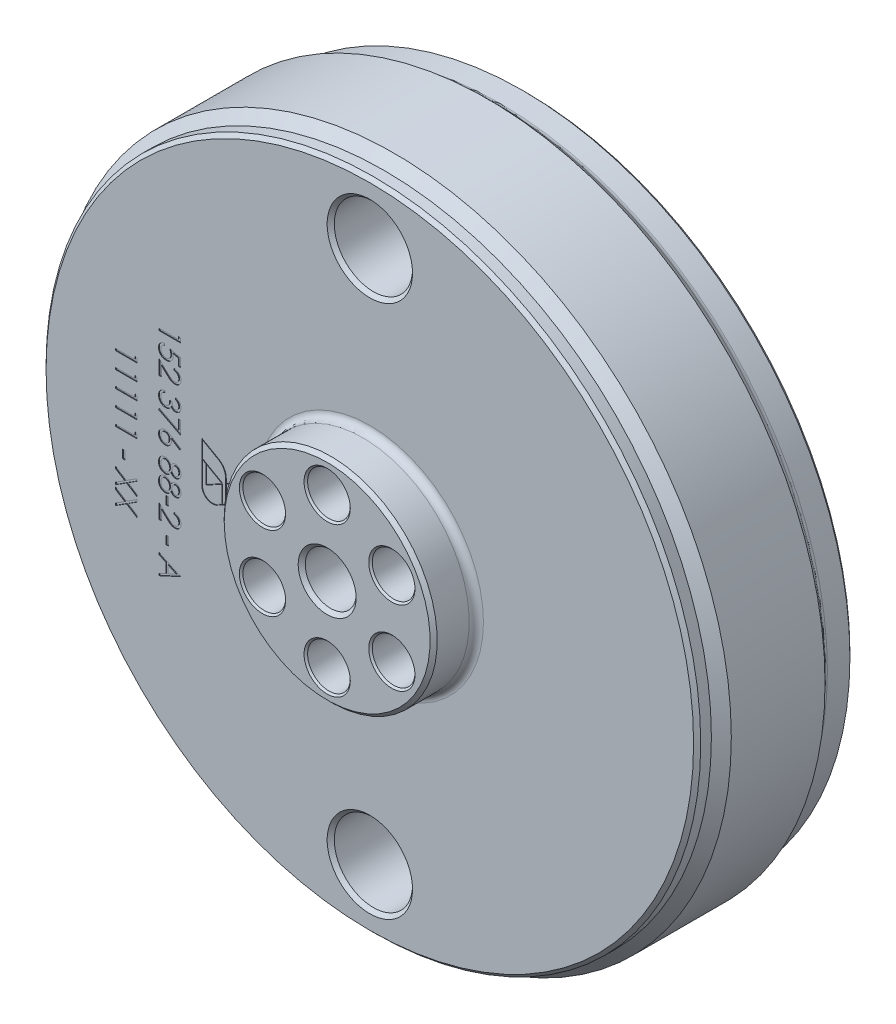
from build123d import *

# Parameters (mm, degrees)
F_11_0_11_DIAMETER_HOLE1_D           = 11
F_11_0_11_DIAMETER_HOLE1_DEPTH       = 10
F_11_0_11_DIAMETER_HOLE1_CSINK_D     = 12
F_11_0_11_DIAMETER_HOLE1_CSINK_ANGLE = 90
F_11_0_11_DIAMETER_HOLE1_TIP         = 3.304733405
CIRPATTERN1_COUNT                    = 6
SKETCH18_W                           = 0.307692308
SKETCH18_H                           = 1.153846154
SKETCH18_W_2                         = 0.307692307
CUT_EXTRUDE1_DEPTH                   = 0.1


with BuildPart() as part:
    # Sketch1 → Revolve1 (revolve)
    with BuildSketch(Plane(origin=(0, 0, 0), x_dir=(0, 0, -1), z_dir=(1, 0, 0))):
        with BuildLine():
            Line((0, 36.85), (0, 45.525))
            Line((0, 45.525), (-0.5, 46.025))
            Line((-0.5, 46.025), (-3.66862915, 46.025))
            ThreePointArc((-3.66862915, 46.025), (-3.974775896, 46.085896374), (-4.234314575, 46.259314575))
            Line((-4.234314575, 46.259314575), (-5.4, 47.425))
            Line((-5.4, 47.425), (-18.58, 47.425))
            Line((-18.58, 47.425), (-19.98, 46.025))
            Line((-19.98, 46.025), (-21.48, 46.025))
            Line((-21.48, 46.025), (-21.98, 45.525))
            Line((-21.98, 45.525), (-21.98, 15.975))
            ThreePointArc((-21.98, 15.975), (-22.272893219, 15.267893219), (-22.98, 14.975))
            Line((-22.98, 14.975), (-27.48, 14.975))
            Line((-27.48, 14.975), (-27.98, 14.475))
            Line((-27.98, 14.475), (-27.98, 4.075))
            Line((-27.98, 4.075), (-27.48, 3.575))
            Line((-27.48, 3.575), (-10.7, 3.575))
            Line((-10.7, 3.575), (-8.2, 6.075))
            Line((-8.2, 6.075), (-8.2, 24.107943651))
            ThreePointArc((-8.2, 24.107943651), (-6.29101439, 30.601896882), (-1.171428571, 35.029706236))
            ThreePointArc((-1.171428571, 35.029706236), (-0.318164268, 35.767674461), (0, 36.85))
        make_face()
    revolve(axis=Axis((0, 0, 0), (0, 0, 1)))

    # Ø11.0 (11) Diameter Hole1
    with Locations(Plane.XY.offset(21.98)):
        with Locations((0, -37.5), (0, 37.5)):
            CounterSinkHole(F_11_0_11_DIAMETER_HOLE1_D / 2, F_11_0_11_DIAMETER_HOLE1_CSINK_D / 2, depth=F_11_0_11_DIAMETER_HOLE1_DEPTH, counter_sink_angle=F_11_0_11_DIAMETER_HOLE1_CSINK_ANGLE)
            with Locations((0, 0, -(F_11_0_11_DIAMETER_HOLE1_DEPTH + F_11_0_11_DIAMETER_HOLE1_TIP / 2))):  # 118° drill point
                Cone(0, F_11_0_11_DIAMETER_HOLE1_D / 2, F_11_0_11_DIAMETER_HOLE1_TIP, mode=Mode.SUBTRACT)

    # Sketch22 → Ø6.0 (6) Diameter Hole1 (revolve, cut)
    with BuildSketch(Plane(origin=(0, 10.5, 27.98), x_dir=(0, -1, 0), z_dir=(1, 0, 0))):
        Polygon((0, 0), (0, 19.78), (3.25, 19.78), (3, 19.53), (3, 0.25), (3.25, 0), align=None)
    f_6_0_6_diameter_hole1 = revolve(axis=Axis((0, 10.5, 34.33), (0, 0, -1)), mode=Mode.SUBTRACT)

    # CirPattern1: Ø6.0 (6) Diameter Hole1 ×6 about axis
    cirpattern1_axis = Axis((0, 0, 0), (0, 0, -1))
    for i in range(1, CIRPATTERN1_COUNT):
        add(f_6_0_6_diameter_hole1.rotate(cirpattern1_axis, i * 360 / CIRPATTERN1_COUNT), mode=Mode.SUBTRACT)

    # Sketch18 → Cut-Extrude1 (cut)
    # profile 1 of 21: a face of its own
    with BuildSketch(Plane.XY.offset(21.98)):
        Polygon((-26.628822217, 13.250619533), (-26.628822217, 12.695932033), (-29.628822217, 12.695932033), (-29.628822217, 12.965162802), (-26.936514525, 12.965162802), (-26.936514525, 13.426701264), align=None)
    # profile 2 of 21: a face of its own
    with BuildSketch(Plane.XY.offset(21.98)):
        with BuildLine():
            Line((-26.628822217, 9.695932033), (-26.936514525, 9.695932033))
            Line((-26.936514525, 9.695932033), (-26.936514525, 10.715763764))
            Line((-26.936514525, 10.715763764), (-27.725577025, 10.878023379))
            add(Edge.make_bspline(
                [(-27.725577025, 10.878023379), (-27.71680822, 10.846261201), (-27.699820049, 10.784727004), (-27.68095796, 10.693904266), (-27.669587579, 10.607682378), (-27.668035027, 10.55173206), (-27.667283755, 10.524657994)],
                knots=[0, 0, 0, 0, 1.100273476, 2.13160584, 3.095893838, 4, 4, 4, 4], degree=3))
            add(Edge.make_bspline(
                [(-27.667283755, 10.524657994), (-27.668009033, 10.491157762), (-27.66943511, 10.425287934), (-27.68312257, 10.328910051), (-27.704680861, 10.236916394), (-27.73474862, 10.149464138), (-27.773445423, 10.066364921), (-27.821157772, 9.988082806), (-27.877555645, 9.91417414), (-27.942094898, 9.845615968), (-28.013212867, 9.783516462), (-28.089429113, 9.728701035), (-28.170812963, 9.68311229), (-28.257004543, 9.645605746), (-28.347859233, 9.615847925), (-28.444049538, 9.595987422), (-28.544721858, 9.582777507), (-28.613553999, 9.581300563), (-28.648653948, 9.580547417)],
                knots=[0, 0, 0, 0, 1.052772836, 2.070014431, 3.053871312, 4.019926262, 4.972333346, 5.930471369, 6.896690565, 7.89035727, 8.885779078, 9.861050232, 10.836829716, 11.812751485, 12.812646763, 13.836748493, 14.896881366, 16, 16, 16, 16], degree=3))
            add(Edge.make_bspline(
                [(-28.648653948, 9.580547417), (-28.673101597, 9.581117405), (-28.721666507, 9.582249678), (-28.793789638, 9.588009593), (-28.864388101, 9.599093162), (-28.933460839, 9.613995237), (-29.000915509, 9.633260375), (-29.066727573, 9.656835492), (-29.131099679, 9.684624743), (-29.194036042, 9.715999467), (-29.253596435, 9.752294207), (-29.310700262, 9.790526479), (-29.363245982, 9.832877314), (-29.413151864, 9.877296294), (-29.458458026, 9.925559551), (-29.501103313, 9.97616907), (-29.539235304, 10.030312532), (-29.574308126, 10.087020566), (-29.60571097, 10.146257413), (-29.63190655, 10.208623723), (-29.654867203, 10.272750392), (-29.673538927, 10.339208975), (-29.688025487, 10.40787072), (-29.697890637, 10.47897207), (-29.705068392, 10.552156252), (-29.705518121, 10.601763303), (-29.705745294, 10.626821456)],
                knots=[0, 0, 0, 0, 1.05623316, 2.098192244, 3.122504159, 4.140841222, 5.148757784, 6.150489607, 7.158294732, 8.176043417, 9.185147859, 10.169157858, 11.142149047, 12.097904048, 13.0527185, 13.998867679, 14.954465986, 15.910220987, 16.877849176, 17.847023716, 18.829548819, 19.818454515, 20.826519638, 21.858115382, 22.918063636, 24, 24, 24, 24], degree=3))
            add(Edge.make_bspline(
                [(-29.705745294, 10.626821456), (-29.705153095, 10.656713574), (-29.703988014, 10.715522786), (-29.691801481, 10.801683793), (-29.674343995, 10.884580122), (-29.648094174, 10.96355572), (-29.61515447, 11.039276907), (-29.573787959, 11.110735688), (-29.526255956, 11.179336619), (-29.470918445, 11.243215208), (-29.409866768, 11.302381948), (-29.344324097, 11.356159376), (-29.274029824, 11.403321858), (-29.19958239, 11.444061861), (-29.120853694, 11.478762301), (-29.037608154, 11.506035642), (-28.950264541, 11.528044742), (-28.890133064, 11.537356372), (-28.859591448, 11.542085879)],
                knots=[0, 0, 0, 0, 1.046825758, 2.059506013, 3.044032586, 4.011925612, 4.970610144, 5.93275819, 6.900651216, 7.891265644, 8.889116719, 9.876966323, 10.858259055, 11.851035124, 12.847502422, 13.86866322, 14.9174643, 16, 16, 16, 16], degree=3))
            Line((-28.859591448, 11.542085879), (-28.859591448, 11.27285511))
            add(Edge.make_bspline(
                [(-28.859591448, 11.27285511), (-28.888202565, 11.266234801), (-28.943194721, 11.2535102), (-29.020413833, 11.225506934), (-29.089485567, 11.191478853), (-29.150475131, 11.150095268), (-29.203938981, 11.101727901), (-29.251994253, 11.046931829), (-29.294773601, 10.98492641), (-29.330661809, 10.916051173), (-29.361224019, 10.843345127), (-29.381585545, 10.767261375), (-29.39589983, 10.689857015), (-29.39733287, 10.637504212), (-29.398052986, 10.611196456)],
                knots=[0, 0, 0, 0, 1.136389429, 2.184203582, 3.172920998, 4.111012962, 5.028380909, 5.957351669, 6.927793475, 7.937618031, 8.960409703, 9.974842029, 10.982339866, 12, 12, 12, 12], degree=3))
            add(Edge.make_bspline(
                [(-29.398052986, 10.611196456), (-29.397349462, 10.585517789), (-29.395964218, 10.534956284), (-29.385302208, 10.460546524), (-29.368881432, 10.388706918), (-29.344307271, 10.320146326), (-29.314440369, 10.253665007), (-29.276113161, 10.190944632), (-29.232004574, 10.130170737), (-29.18147032, 10.073232337), (-29.12578201, 10.021084238), (-29.066229959, 9.975007563), (-29.002701233, 9.936627351), (-28.936295673, 9.904283829), (-28.866285482, 9.879723859), (-28.79299876, 9.862203018), (-28.716254491, 9.851914682), (-28.663909369, 9.850499385), (-28.637235679, 9.849778187)],
                knots=[0, 0, 0, 0, 1.027316725, 2.022795036, 3.002884548, 3.971462791, 4.93288096, 5.914575861, 6.907176829, 7.935150275, 8.956128384, 9.956726525, 10.942570165, 11.921478529, 12.907843606, 13.90538589, 14.932640048, 16, 16, 16, 16], degree=3))
            add(Edge.make_bspline(
                [(-28.637235679, 9.849778187), (-28.613156248, 9.850251689), (-28.565997179, 9.851179035), (-28.497306463, 9.861484119), (-28.431840212, 9.875919942), (-28.370183867, 9.898084308), (-28.311434561, 9.925470263), (-28.256849744, 9.960214621), (-28.205027037, 9.999931002), (-28.158071716, 10.046449868), (-28.114441636, 10.097176716), (-28.07730271, 10.153289084), (-28.046044376, 10.213507095), (-28.019072786, 10.277133787), (-27.999700445, 10.34567476), (-27.98515662, 10.417774835), (-27.976743431, 10.494211984), (-27.975576101, 10.546472578), (-27.974976063, 10.573335879)],
                knots=[0, 0, 0, 0, 1.045726679, 2.048034203, 3.01323695, 3.95502507, 4.889743367, 5.8246644, 6.761650845, 7.722168973, 8.692072792, 9.66525385, 10.638902184, 11.638179751, 12.663148338, 13.728659964, 14.832472288, 16, 16, 16, 16], degree=3))
            add(Edge.make_bspline(
                [(-27.974976063, 10.573335879), (-27.975456814, 10.596791184), (-27.976440985, 10.644807836), (-27.984186208, 10.718633355), (-27.996101488, 10.795875298), (-28.013275209, 10.876833542), (-28.03477789, 10.961285912), (-28.061632043, 11.049372853), (-28.092564641, 11.141096492), (-28.116557018, 11.20283307), (-28.128822217, 11.234393571)],
                knots=[0, 0, 0, 0, 0.824638674, 1.688163388, 2.607705698, 3.571998603, 4.597075385, 5.671199175, 6.809488238, 8, 8, 8, 8], degree=3))
            Line((-28.128822217, 11.234393571), (-26.628822217, 10.926701264))
            Line((-26.628822217, 10.926701264), (-26.628822217, 9.695932033))
        make_face()
    # profile 3 of 21: a face of its own
    with BuildSketch(Plane.XY.offset(21.98)):
        with BuildLine():
            Line((-27.55189914, 8.888239725), (-27.55189914, 9.157470494))
            add(Edge.make_bspline(
                [(-27.55189914, 9.157470494), (-27.51618106, 9.15571609), (-27.446031702, 9.152270488), (-27.343756559, 9.136127728), (-27.245986286, 9.113050843), (-27.153559084, 9.080345514), (-27.065370832, 9.03995729), (-26.982592567, 8.990510416), (-26.904402726, 8.933059019), (-26.832281702, 8.867708496), (-26.766354068, 8.796797156), (-26.708819713, 8.720749867), (-26.660764983, 8.640348253), (-26.620373874, 8.556289682), (-26.590092255, 8.467601993), (-26.567613922, 8.375132939), (-26.554092061, 8.278464571), (-26.552638431, 8.212601769), (-26.55189914, 8.17910511)],
                knots=[0, 0, 0, 0, 1.100776268, 2.161895295, 3.184016182, 4.190939212, 5.176500551, 6.166955529, 7.155448256, 8.160289653, 9.16017456, 10.133824356, 11.091467644, 12.04088621, 13.000931625, 13.972173743, 14.968683325, 16, 16, 16, 16], degree=3))
            add(Edge.make_bspline(
                [(-26.55189914, 8.17910511), (-26.552669246, 8.146209618), (-26.554182475, 8.081571151), (-26.567177643, 7.987232281), (-26.587531008, 7.897423172), (-26.616087079, 7.812319372), (-26.654473731, 7.732599888), (-26.700585907, 7.65766585), (-26.753917191, 7.586625155), (-26.816706174, 7.522676483), (-26.883736789, 7.463955272), (-26.955297849, 7.413296196), (-27.029208666, 7.369913485), (-27.106032838, 7.333752616), (-27.18649372, 7.307133069), (-27.269419894, 7.286923176), (-27.355669732, 7.275499679), (-27.414046779, 7.273746459), (-27.443726063, 7.27285511)],
                knots=[0, 0, 0, 0, 1.111607364, 2.184268762, 3.212621178, 4.221274766, 5.211760367, 6.196651075, 7.1921475, 8.207485113, 9.220403448, 10.201281604, 11.166441695, 12.114753415, 13.065576456, 14.026450734, 14.996634279, 16, 16, 16, 16], degree=3))
            add(Edge.make_bspline(
                [(-27.443726063, 7.27285511), (-27.485509907, 7.274304523), (-27.568344347, 7.277177916), (-27.690258855, 7.301856794), (-27.808284761, 7.34025143), (-27.903643566, 7.385879093), (-27.980003694, 7.432628056), (-28.042989268, 7.474678147), (-28.110790087, 7.523941471), (-28.183200423, 7.58109208), (-28.260780833, 7.644960991), (-28.343486482, 7.716122624), (-28.430462252, 7.795085674), (-28.489867058, 7.850507237), (-28.52064914, 7.879225302)],
                knots=[0, 0, 0, 0, 1.184136889, 2.347493852, 3.513608722, 4.697895552, 5.335178528, 6.052199267, 6.845488095, 7.711597353, 8.668264519, 9.695616787, 10.805926351, 12, 12, 12, 12], degree=3))
            Line((-28.52064914, 7.879225302), (-29.321129909, 8.629826264))
            Line((-29.321129909, 8.629826264), (-29.321129909, 7.234393571))
            Line((-29.321129909, 7.234393571), (-29.628822217, 7.234393571))
            Line((-29.628822217, 7.234393571), (-29.628822217, 9.27285511))
            Line((-29.628822217, 9.27285511), (-28.387235679, 8.109393571))
            add(Edge.make_bspline(
                [(-28.387235679, 8.109393571), (-28.357667314, 8.081064806), (-28.300872538, 8.026651044), (-28.217928782, 7.949720935), (-28.141071065, 7.880514184), (-28.069958814, 7.818984883), (-28.004995167, 7.765082406), (-27.94567102, 7.718979216), (-27.892495475, 7.680471545), (-27.830027069, 7.639661439), (-27.753666329, 7.600746295), (-27.660818905, 7.566543865), (-27.565028397, 7.545838179), (-27.500315611, 7.543341653), (-27.467764525, 7.542085879)],
                knots=[0, 0, 0, 0, 1.329530082, 2.553755191, 3.672934919, 4.687409497, 5.60679272, 6.413407421, 7.126401618, 7.737995624, 8.834647426, 9.90044882, 10.943907757, 12, 12, 12, 12], degree=3))
            add(Edge.make_bspline(
                [(-27.467764525, 7.542085879), (-27.447292493, 7.542625203), (-27.406946049, 7.543688109), (-27.347830711, 7.553246448), (-27.29058597, 7.567289546), (-27.235919617, 7.588934297), (-27.18275647, 7.614939669), (-27.132712854, 7.64816345), (-27.084082903, 7.686129507), (-27.038534097, 7.73016827), (-26.996804317, 7.77851465), (-26.959841607, 7.829597094), (-26.928950734, 7.883639607), (-26.903627792, 7.940416971), (-26.883763165, 7.999770199), (-26.869998672, 8.061814275), (-26.861356542, 8.126377715), (-26.860187252, 8.170463569), (-26.859591448, 8.192927225)],
                knots=[0, 0, 0, 0, 0.991504627, 1.954065223, 2.895985987, 3.842598665, 4.797835564, 5.759220273, 6.74786863, 7.784730864, 8.824135544, 9.839918996, 10.835834653, 11.835434876, 12.84861661, 13.863796685, 14.911511676, 16, 16, 16, 16], degree=3))
            add(Edge.make_bspline(
                [(-26.859591448, 8.192927225), (-26.860204147, 8.216388043), (-26.861407388, 8.262461216), (-26.869829444, 8.330104624), (-26.884344878, 8.394640667), (-26.90424523, 8.456199986), (-26.929299932, 8.514841892), (-26.961108762, 8.570036145), (-26.998429786, 8.62228665), (-27.040973717, 8.671497442), (-27.088564146, 8.716714439), (-27.140961946, 8.757277759), (-27.198507959, 8.791873983), (-27.259902395, 8.822541979), (-27.326777654, 8.846007534), (-27.397513196, 8.866065665), (-27.473114003, 8.880636414), (-27.525201247, 8.885663194), (-27.55189914, 8.888239725)],
                knots=[0, 0, 0, 0, 1.031212865, 2.025131798, 2.990757446, 3.934781266, 4.865570067, 5.788494791, 6.729227313, 7.684356718, 8.643577152, 9.610526866, 10.590658432, 11.59095419, 12.621640561, 13.700587263, 14.82141059, 16, 16, 16, 16], degree=3))
        make_face()
    # profile 4 of 21: a face of its own
    with BuildSketch(Plane.XY.offset(21.98)):
        with BuildLine():
            Line((-27.321129909, 5.426701264), (-27.321129909, 5.695932033))
            add(Edge.make_bspline(
                [(-27.321129909, 5.695932033), (-27.290930637, 5.688638132), (-27.231893531, 5.674379153), (-27.14754445, 5.644638376), (-27.067724289, 5.612239014), (-26.993927654, 5.573334067), (-26.924671452, 5.530897992), (-26.861526488, 5.482278517), (-26.802886803, 5.429718755), (-26.750846885, 5.371583084), (-26.703723118, 5.31061566), (-26.663544497, 5.245957414), (-26.628980937, 5.178909219), (-26.600506453, 5.109006534), (-26.579056004, 5.036041244), (-26.563493028, 4.960672996), (-26.553386358, 4.882704281), (-26.55239999, 4.829777775), (-26.55189914, 4.802903187)],
                knots=[0, 0, 0, 0, 1.162005537, 2.271625781, 3.343758855, 4.383309926, 5.390229558, 6.379919256, 7.361854164, 8.333198761, 9.295911338, 10.242430842, 11.177959212, 12.116337295, 13.062827104, 14.020064771, 14.994644689, 16, 16, 16, 16], degree=3))
            add(Edge.make_bspline(
                [(-26.55189914, 4.802903187), (-26.553081337, 4.763746551), (-26.555419945, 4.686287398), (-26.576775176, 4.572490501), (-26.610568147, 4.462753227), (-26.657259913, 4.358276729), (-26.714849039, 4.261232358), (-26.783390242, 4.174887056), (-26.861561071, 4.100411189), (-26.947903269, 4.037930294), (-27.04017942, 3.989008866), (-27.135150984, 3.952934832), (-27.232592673, 3.930973391), (-27.298384627, 3.928127199), (-27.331346255, 3.926701264)],
                knots=[0, 0, 0, 0, 1.083050992, 2.142477498, 3.193116406, 4.255571735, 5.30263384, 6.308962982, 7.297363603, 8.282367274, 9.249857812, 10.179914175, 11.08814088, 12, 12, 12, 12], degree=3))
            add(Edge.make_bspline(
                [(-27.331346255, 3.926701264), (-27.363066365, 3.927698627), (-27.425137698, 3.929650313), (-27.515756124, 3.946222061), (-27.60116321, 3.974110286), (-27.681718492, 4.012741511), (-27.756911211, 4.062748554), (-27.826910546, 4.123325152), (-27.892026968, 4.194898862), (-27.929329373, 4.249137952), (-27.948533755, 4.27706184)],
                knots=[0, 0, 0, 0, 1.024540389, 2.004866551, 2.965041327, 3.920577974, 4.882998113, 5.874504559, 6.905732034, 8, 8, 8, 8], degree=3))
            add(Edge.make_bspline(
                [(-27.948533755, 4.27706184), (-27.963943617, 4.245148908), (-27.994475009, 4.181920159), (-28.054351373, 4.09573399), (-28.123485385, 4.017495812), (-28.17743623, 3.973864052), (-28.204543371, 3.951941648)],
                knots=[0, 0, 0, 0, 1.015518401, 2.012035669, 3.001164323, 4, 4, 4, 4], degree=3))
            add(Edge.make_bspline(
                [(-28.204543371, 3.951941648), (-28.224305052, 3.937500336), (-28.263504802, 3.908854198), (-28.326566795, 3.8735953), (-28.390118994, 3.841242885), (-28.456660188, 3.817432445), (-28.524052957, 3.796884978), (-28.59374045, 3.783365429), (-28.665060576, 3.774686419), (-28.713332038, 3.773467709), (-28.737596255, 3.77285511)],
                knots=[0, 0, 0, 0, 1.02516404, 2.033540309, 3.025129118, 4.011046665, 4.991655828, 5.976607087, 6.982917762, 8, 8, 8, 8], degree=3))
            add(Edge.make_bspline(
                [(-28.737596255, 3.77285511), (-28.779602917, 3.774396651), (-28.863418557, 3.777472479), (-28.98727909, 3.804853739), (-29.108145438, 3.847546947), (-29.224226756, 3.907114835), (-29.332609536, 3.98081596), (-29.429142704, 4.068984251), (-29.512678917, 4.169476351), (-29.582250329, 4.28163456), (-29.637904457, 4.403095718), (-29.676522349, 4.533020556), (-29.701676818, 4.669519812), (-29.70437403, 4.763126176), (-29.705745294, 4.810715687)],
                knots=[0, 0, 0, 0, 0.95570045, 1.906903359, 2.87519758, 3.868912786, 4.869932978, 5.851730567, 6.836639976, 7.83677598, 8.849487602, 9.869908895, 10.917060885, 12, 12, 12, 12], degree=3))
            add(Edge.make_bspline(
                [(-29.705745294, 4.810715687), (-29.705001111, 4.842789373), (-29.703536808, 4.905899691), (-29.693526578, 4.998679833), (-29.675243716, 5.087241289), (-29.650640883, 5.171703802), (-29.619447961, 5.252142404), (-29.580603363, 5.328311637), (-29.53490779, 5.400680118), (-29.481821857, 5.468564933), (-29.422437852, 5.531957991), (-29.355701558, 5.589174612), (-29.28284664, 5.64116872), (-29.203026878, 5.686548124), (-29.1172738, 5.727379798), (-29.024489373, 5.760963475), (-28.925503068, 5.790522534), (-28.856522148, 5.804265503), (-28.821129909, 5.811316648)],
                knots=[0, 0, 0, 0, 1.048658725, 2.063410685, 3.046034179, 4.001477787, 4.936774919, 5.862367409, 6.792675028, 7.730719943, 8.675894397, 9.627829632, 10.600096036, 11.597688215, 12.626045268, 13.701542398, 14.82072376, 16, 16, 16, 16], degree=3))
            Line((-28.821129909, 5.811316648), (-28.821129909, 5.542085879))
            add(Edge.make_bspline(
                [(-28.821129909, 5.542085879), (-28.844229064, 5.535071629), (-28.889158925, 5.521428304), (-28.953822044, 5.49820462), (-29.013100375, 5.471746101), (-29.067428766, 5.443362194), (-29.117342254, 5.413552097), (-29.161520998, 5.380196447), (-29.201905457, 5.345765751), (-29.224657982, 5.31981202), (-29.235793371, 5.307109917)],
                knots=[0, 0, 0, 0, 1.198163088, 2.33053128, 3.407730985, 4.417276592, 5.372219308, 6.28897303, 7.162600585, 8, 8, 8, 8], degree=3))
            add(Edge.make_bspline(
                [(-29.235793371, 5.307109917), (-29.248743371, 5.290312852), (-29.274603399, 5.256770569), (-29.307604794, 5.202112086), (-29.336199959, 5.144627897), (-29.358043127, 5.083072462), (-29.376538265, 5.018774088), (-29.388641567, 4.950693489), (-29.396945714, 4.879431303), (-29.397678512, 4.83077322), (-29.398052986, 4.805907994)],
                knots=[0, 0, 0, 0, 0.946170439, 1.889420265, 2.845303464, 3.807233317, 4.801018734, 5.828864929, 6.890507805, 8, 8, 8, 8], degree=3))
            add(Edge.make_bspline(
                [(-29.398052986, 4.805907994), (-29.397525926, 4.777833183), (-29.396495305, 4.722935314), (-29.386989847, 4.642836459), (-29.373206637, 4.566611104), (-29.351647016, 4.495037131), (-29.32578269, 4.427140593), (-29.291921539, 4.364437136), (-29.253680844, 4.305083357), (-29.20919956, 4.250818047), (-29.161120108, 4.201895217), (-29.110112093, 4.159620486), (-29.057757097, 4.123005735), (-29.002833783, 4.093573585), (-28.945880906, 4.070291373), (-28.886685288, 4.054451382), (-28.825745396, 4.043435065), (-28.784320481, 4.042538068), (-28.763437602, 4.042085879)],
                knots=[0, 0, 0, 0, 1.216990249, 2.379719373, 3.493992396, 4.571561497, 5.616923107, 6.638958652, 7.655775068, 8.674704564, 9.676001865, 10.625896028, 11.54399481, 12.441854662, 13.322657739, 14.20572845, 15.095482574, 16, 16, 16, 16], degree=3))
            add(Edge.make_bspline(
                [(-28.763437602, 4.042085879), (-28.735484994, 4.043397543), (-28.679718867, 4.046014343), (-28.597675705, 4.065993475), (-28.51862522, 4.098853998), (-28.443927488, 4.144864338), (-28.374663352, 4.200846006), (-28.313104514, 4.2662571), (-28.261798772, 4.341258075), (-28.226481824, 4.410731798), (-28.202944563, 4.472417801), (-28.186440676, 4.525102549), (-28.173247761, 4.584136906), (-28.16048624, 4.648812176), (-28.14978779, 4.719401129), (-28.140827419, 4.795967359), (-28.133668977, 4.87854167), (-28.130470463, 4.935705412), (-28.128822217, 4.965162802)],
                knots=[0, 0, 0, 0, 1.070481957, 2.135637345, 3.216366529, 4.339485895, 5.485746587, 6.620975969, 7.768829582, 8.956804399, 9.598399438, 10.297751078, 11.070570279, 11.915248466, 12.824061284, 13.805856426, 14.869322739, 16, 16, 16, 16], degree=3))
            Line((-28.128822217, 4.965162802), (-27.821129909, 4.965162802))
            add(Edge.make_bspline(
                [(-27.821129909, 4.965162802), (-27.820497331, 4.928048543), (-27.819258267, 4.855350827), (-27.804375772, 4.749141268), (-27.783557121, 4.647458168), (-27.752404777, 4.55262256), (-27.715013074, 4.466465124), (-27.672851198, 4.391306253), (-27.625083684, 4.328927184), (-27.572337435, 4.279172067), (-27.515105856, 4.242653579), (-27.456080001, 4.215242836), (-27.393886535, 4.199173547), (-27.351466548, 4.197016342), (-27.330144332, 4.195932033)],
                knots=[0, 0, 0, 0, 1.321708579, 2.588902423, 3.815526512, 5.016621128, 6.138757764, 7.158873101, 8.079948563, 8.928590313, 9.728601868, 10.489025425, 11.240515403, 12, 12, 12, 12], degree=3))
            add(Edge.make_bspline(
                [(-27.330144332, 4.195932033), (-27.314477656, 4.196287201), (-27.283309546, 4.196993791), (-27.237774326, 4.20590635), (-27.193628595, 4.21929612), (-27.151072661, 4.237715994), (-27.110353538, 4.262325734), (-27.071421271, 4.291865621), (-27.033623397, 4.326349912), (-26.998768211, 4.366679853), (-26.965890846, 4.410341315), (-26.937469587, 4.457745125), (-26.913379746, 4.507845735), (-26.893476403, 4.560689215), (-26.87851391, 4.616487255), (-26.867768172, 4.674966637), (-26.861050385, 4.736241941), (-26.860083144, 4.778046262), (-26.859591448, 4.799297417)],
                knots=[0, 0, 0, 0, 0.884317272, 1.759307272, 2.611736065, 3.488921043, 4.37244062, 5.294096728, 6.247679003, 7.258495569, 8.302441962, 9.333537773, 10.376747089, 11.440883505, 12.520330301, 13.637364711, 14.798958396, 16, 16, 16, 16], degree=3))
            add(Edge.make_bspline(
                [(-26.859591448, 4.799297417), (-26.86078173, 4.833457119), (-26.863106629, 4.90017896), (-26.883541443, 4.996347448), (-26.915918299, 5.085656786), (-26.955013256, 5.153692486), (-26.993472221, 5.204017695), (-27.026558468, 5.240669099), (-27.064071496, 5.276004807), (-27.107040245, 5.308638214), (-27.153987192, 5.340524782), (-27.205170905, 5.371360042), (-27.261321111, 5.400153566), (-27.300807553, 5.417680655), (-27.321129909, 5.426701264)],
                knots=[0, 0, 0, 0, 1.4727372, 2.876598283, 4.222346151, 5.558423782, 6.24313385, 6.953189256, 7.68715613, 8.463578749, 9.278833271, 10.135787152, 11.040551781, 12, 12, 12, 12], degree=3))
        make_face()
    # profile 5 of 21: a face of its own
    with BuildSketch(Plane.XY.offset(21.98)):
        Polygon((-26.628822217, 3.311316648), (-26.628822217, 1.465162802), (-29.705745294, 3.042085879), (-29.577740486, 3.274657994), (-26.936514525, 1.92129261), (-26.936514525, 3.311316648), align=None)
    # profile 6 of 21: a face of its own
    with BuildSketch(Plane.XY.offset(21.98)):
        with BuildLine():
            Line((-26.55189914, -0.188683352), (-26.714759717, -0.396616044))
            Line((-26.714759717, -0.396616044), (-27.92689914, 0.396052225))
            add(Edge.make_bspline(
                [(-27.92689914, 0.396052225), (-27.91848726, 0.343277702), (-27.902078935, 0.240335028), (-27.899372125, 0.136135686), (-27.898052986, 0.08535511)],
                knots=[0, 0, 0, 0, 1.025318673, 2, 2, 2, 2], degree=3))
            add(Edge.make_bspline(
                [(-27.898052986, 0.08535511), (-27.898860641, 0.054862864), (-27.900445227, -0.004961687), (-27.912967724, -0.092865487), (-27.932458922, -0.177351824), (-27.960985473, -0.25823222), (-27.997414072, -0.335609324), (-28.041076501, -0.409925592), (-28.094224079, -0.479784478), (-28.153594082, -0.546085483), (-28.219351486, -0.606280139), (-28.289124064, -0.659573901), (-28.362839104, -0.704339722), (-28.440459275, -0.740660227), (-28.521864926, -0.768864408), (-28.606951903, -0.789425247), (-28.695778878, -0.801579184), (-28.756188743, -0.803229604), (-28.786875102, -0.804067967)],
                knots=[0, 0, 0, 0, 1.044136307, 2.048553127, 3.035567123, 4.010001674, 4.980053131, 5.96154148, 6.956538004, 7.981742224, 9.006487041, 10.005615874, 10.984750588, 11.954802044, 12.935714515, 13.930994945, 14.949008866, 16, 16, 16, 16], degree=3))
            add(Edge.make_bspline(
                [(-28.786875102, -0.804067967), (-28.828832748, -0.802502371), (-28.911346786, -0.799423465), (-29.032030284, -0.777010338), (-29.146080075, -0.738330287), (-29.253944354, -0.686581018), (-29.352484805, -0.61944041), (-29.441538949, -0.539875098), (-29.519162718, -0.447132968), (-29.585752916, -0.343410173), (-29.638658744, -0.231149898), (-29.677773103, -0.113441327), (-29.701144926, 0.00870943), (-29.704204784, 0.091666601), (-29.705745294, 0.133432033)],
                knots=[0, 0, 0, 0, 1.031881447, 2.029301251, 3.006342947, 3.987068354, 4.962916383, 5.929513747, 6.915671209, 7.928552063, 8.953527267, 9.960179832, 10.973036711, 12, 12, 12, 12], degree=3))
            add(Edge.make_bspline(
                [(-29.705745294, 0.133432033), (-29.704435407, 0.173800641), (-29.701840749, 0.253763786), (-29.67872704, 0.371391782), (-29.641263992, 0.484417656), (-29.589651064, 0.592046932), (-29.524461157, 0.69175635), (-29.44596975, 0.780933216), (-29.355911594, 0.859267267), (-29.254010422, 0.924114002), (-29.14521614, 0.976964267), (-29.030740922, 1.014240323), (-28.912888629, 1.038346845), (-28.832665191, 1.04083396), (-28.792283755, 1.042085879)],
                knots=[0, 0, 0, 0, 1.011913813, 2.004424092, 2.994488568, 3.992479987, 4.990471406, 5.973328987, 6.963763268, 7.974390938, 8.994854117, 9.989689954, 10.988086187, 12, 12, 12, 12], degree=3))
            add(Edge.make_bspline(
                [(-28.792283755, 1.042085879), (-28.761399648, 1.040998638), (-28.698368261, 1.038779686), (-28.602629313, 1.02553724), (-28.505051687, 1.001248976), (-28.422332556, 0.974963766), (-28.353826128, 0.948880904), (-28.299728412, 0.924696273), (-28.242599486, 0.897654909), (-28.183520287, 0.865958665), (-28.120802794, 0.832358088), (-28.056769627, 0.793108801), (-27.989082096, 0.752151568), (-27.94401679, 0.722147342), (-27.920889525, 0.70674934)],
                knots=[0, 0, 0, 0, 1.17367173, 2.395347028, 3.66355231, 4.98980831, 5.690886799, 6.447442954, 7.240630024, 8.091733897, 8.994365608, 9.943299771, 10.944512865, 12, 12, 12, 12], degree=3))
            Line((-27.920889525, 0.70674934), (-26.55189914, -0.188683352))
        make_face()
        with BuildLine():
            add(Edge.make_bspline(
                [(-28.205745294, 0.141845494), (-28.206421024, 0.164698129), (-28.207746801, 0.209534809), (-28.215234769, 0.275233742), (-28.229422502, 0.337245535), (-28.24777439, 0.396278898), (-28.27276277, 0.451716982), (-28.30275233, 0.504197966), (-28.338421284, 0.553179575), (-28.379311107, 0.597882168), (-28.423695616, 0.638779694), (-28.47087143, 0.674782998), (-28.520647346, 0.705133962), (-28.572595096, 0.729931898), (-28.626986151, 0.749197801), (-28.683520384, 0.763145088), (-28.7425904, 0.770904618), (-28.782646747, 0.772195788), (-28.803101063, 0.77285511)],
                knots=[0, 0, 0, 0, 1.129054775, 2.21519617, 3.259426851, 4.267013074, 5.263608451, 6.256463875, 7.247987236, 8.249677815, 9.244060445, 10.225610515, 11.175892485, 12.118571871, 13.063688666, 14.021206195, 14.989551517, 16, 16, 16, 16], degree=3))
            add(Edge.make_bspline(
                [(-28.803101063, 0.77285511), (-28.823371703, 0.772316845), (-28.86311941, 0.771261388), (-28.92170686, 0.761721998), (-28.978035481, 0.747046454), (-29.03214647, 0.725565348), (-29.083744662, 0.698621759), (-29.133196572, 0.665464702), (-29.180536334, 0.626655605), (-29.224570207, 0.581540801), (-29.264959146, 0.532888859), (-29.300921532, 0.481436207), (-29.331120321, 0.427346446), (-29.354994843, 0.370310933), (-29.374548646, 0.311128212), (-29.388318344, 0.249346796), (-29.396100918, 0.184912401), (-29.397393756, 0.141265097), (-29.398052986, 0.119008956)],
                knots=[0, 0, 0, 0, 0.989642335, 1.94054129, 2.892446913, 3.828371744, 4.778262963, 5.730973156, 6.732161388, 7.763274768, 8.805796303, 9.818398792, 10.825975928, 11.825728216, 12.834635236, 13.867465554, 14.912602056, 16, 16, 16, 16], degree=3))
            add(Edge.make_bspline(
                [(-29.398052986, 0.119008956), (-29.397393808, 0.096752778), (-29.396101071, 0.053105402), (-29.388317763, -0.011328474), (-29.374550781, -0.073111806), (-29.354987106, -0.132287564), (-29.331149022, -0.189348782), (-29.300732302, -0.243485891), (-29.265177799, -0.295429779), (-29.224500693, -0.344049804), (-29.180785146, -0.389353176), (-29.132767943, -0.427253278), (-29.084137698, -0.461457841), (-29.031940854, -0.487366603), (-28.978068055, -0.509086942), (-28.921698134, -0.523688441), (-28.863121694, -0.533247573), (-28.823372474, -0.534300317), (-28.803101063, -0.534837198)],
                knots=[0, 0, 0, 0, 1.087205562, 2.132157158, 3.164804748, 4.173533273, 5.173108684, 6.180507559, 7.20098426, 8.243321352, 9.274252308, 10.269075238, 11.227079059, 12.172305571, 13.108064818, 14.05980203, 15.010532752, 16, 16, 16, 16], degree=3))
            add(Edge.make_bspline(
                [(-28.803101063, -0.534837198), (-28.782617642, -0.534371016), (-28.742415349, -0.533456052), (-28.683574121, -0.522906902), (-28.626524504, -0.508658519), (-28.572551631, -0.485631826), (-28.520162935, -0.458205156), (-28.470855725, -0.423265379), (-28.423233118, -0.38320607), (-28.37904829, -0.336813503), (-28.338633252, -0.286342544), (-28.302960203, -0.232670356), (-28.272852868, -0.176521108), (-28.247732503, -0.11794904), (-28.229604565, -0.056283738), (-28.215329597, 0.007479395), (-28.207759228, 0.073956741), (-28.206423228, 0.118992669), (-28.205745294, 0.141845494)],
                knots=[0, 0, 0, 0, 0.978850575, 1.921165339, 2.853482305, 3.786193361, 4.721019802, 5.678231452, 6.671107257, 7.694736563, 8.738100728, 9.761595396, 10.773671158, 11.783065439, 12.804898115, 13.84455739, 14.906252091, 16, 16, 16, 16], degree=3))
        make_face(mode=Mode.SUBTRACT)
    # profile 7 of 21: a face of its own
    with BuildSketch(Plane.XY.offset(21.98)):
        with BuildLine():
            add(Edge.make_bspline(
                [(-27.957548179, -3.724140083), (-27.970367794, -3.74848838), (-27.995448533, -3.796124233), (-28.035702991, -3.864282104), (-28.077754049, -3.927033916), (-28.12028169, -3.985273966), (-28.164966904, -4.037814353), (-28.211299639, -4.085002739), (-28.258038789, -4.128319544), (-28.307013179, -4.165487447), (-28.357212701, -4.198262696), (-28.409068868, -4.2265496), (-28.462418118, -4.250738217), (-28.51785598, -4.269905801), (-28.574564618, -4.285696085), (-28.633277216, -4.296560842), (-28.69360664, -4.302403927), (-28.734379471, -4.303508622), (-28.75502414, -4.304067967)],
                knots=[0, 0, 0, 0, 1.264385854, 2.473688339, 3.635349404, 4.734491366, 5.785876313, 6.801388178, 7.772322209, 8.711311751, 9.622826105, 10.524996139, 11.423212571, 12.31118177, 13.217849097, 14.126010572, 15.051135535, 16, 16, 16, 16], degree=3))
            add(Edge.make_bspline(
                [(-28.75502414, -4.304067967), (-28.783909894, -4.303412631), (-28.84108564, -4.302115476), (-28.925439186, -4.290629976), (-29.00755858, -4.273867129), (-29.08664991, -4.247763752), (-29.163704286, -4.216584894), (-29.23731283, -4.176475117), (-29.309533821, -4.13146321), (-29.353945937, -4.095235598), (-29.376418371, -4.076904506)],
                knots=[0, 0, 0, 0, 1.02534174, 2.029536028, 3.018826961, 3.997522084, 4.983122576, 5.966563916, 6.971085759, 8, 8, 8, 8], degree=3))
            add(Edge.make_bspline(
                [(-29.376418371, -4.076904506), (-29.402641606, -4.053044671), (-29.454764028, -4.005619843), (-29.522436151, -3.924377334), (-29.57930706, -3.835215719), (-29.625654398, -3.738480005), (-29.661727992, -3.634428775), (-29.68765015, -3.5230842), (-29.702497946, -3.404229212), (-29.704644223, -3.322538808), (-29.705745294, -3.280630467)],
                knots=[0, 0, 0, 0, 0.954267603, 1.896743057, 2.838368354, 3.796610408, 4.779680527, 5.799409237, 6.871065594, 8, 8, 8, 8], degree=3))
            add(Edge.make_bspline(
                [(-29.705745294, -3.280630467), (-29.704754805, -3.240334205), (-29.702827413, -3.161921772), (-29.689840111, -3.047773673), (-29.666847624, -2.941240529), (-29.636028437, -2.841817271), (-29.594930351, -2.750465198), (-29.544555976, -2.667018544), (-29.486043131, -2.59025304), (-29.417981644, -2.52258136), (-29.345072863, -2.462506413), (-29.269857716, -2.409733577), (-29.192326134, -2.365870137), (-29.113634997, -2.328732612), (-29.032681142, -2.300302882), (-28.949881133, -2.280612415), (-28.865379581, -2.268107289), (-28.80835245, -2.266443459), (-28.779663563, -2.265606429)],
                knots=[0, 0, 0, 0, 1.256882982, 2.445766618, 3.576898315, 4.651879663, 5.686612882, 6.692806257, 7.686348993, 8.689277895, 9.678883454, 10.630458183, 11.551151498, 12.454054546, 13.341321255, 14.221808008, 15.105437234, 16, 16, 16, 16], degree=3))
            add(Edge.make_bspline(
                [(-28.779663563, -2.265606429), (-28.758612811, -2.266101731), (-28.717009095, -2.267080624), (-28.655544187, -2.273856554), (-28.595718075, -2.284748241), (-28.537314882, -2.299546796), (-28.480740938, -2.319578695), (-28.425798562, -2.343851804), (-28.372065617, -2.371880546), (-28.320465834, -2.405476062), (-28.269279562, -2.44246309), (-28.221006949, -2.486338112), (-28.172958823, -2.534458726), (-28.127214223, -2.588789638), (-28.081574483, -2.647667914), (-28.038944044, -2.712878108), (-27.996203761, -2.782588114), (-27.970654455, -2.832136319), (-27.957548179, -2.857553544)],
                knots=[0, 0, 0, 0, 0.941717298, 1.86116577, 2.762973304, 3.660719123, 4.553575492, 5.444450535, 6.34648071, 7.261375261, 8.197060099, 9.168336537, 10.175980388, 11.237504102, 12.343496232, 13.506792996, 14.721035322, 16, 16, 16, 16], degree=3))
            add(Edge.make_bspline(
                [(-27.957548179, -2.857553544), (-27.938578475, -2.822757333), (-27.901847821, -2.75538213), (-27.834310522, -2.666228569), (-27.761431019, -2.589526422), (-27.680800623, -2.528248221), (-27.595970596, -2.479623466), (-27.507212779, -2.445286343), (-27.415589961, -2.422863777), (-27.353109808, -2.420593012), (-27.321730871, -2.419452583)],
                knots=[0, 0, 0, 0, 1.16709546, 2.25982348, 3.287408737, 4.277418348, 5.234967981, 6.16072867, 7.076276605, 8, 8, 8, 8], degree=3))
            add(Edge.make_bspline(
                [(-27.321730871, -2.419452583), (-27.289761569, -2.420854402), (-27.225497697, -2.423672303), (-27.129834784, -2.446457588), (-27.035879822, -2.483590751), (-26.944075208, -2.534087825), (-26.85757843, -2.597016762), (-26.779738774, -2.672499389), (-26.712142961, -2.759244157), (-26.655035802, -2.855710907), (-26.608325677, -2.959321009), (-26.576439534, -3.068827611), (-26.555467428, -3.182273794), (-26.553099676, -3.259501886), (-26.55189914, -3.298659313)],
                knots=[0, 0, 0, 0, 0.888753872, 1.786550278, 2.720173491, 3.693036334, 4.694165094, 5.687489879, 6.699912706, 7.744713188, 8.800178723, 9.852977058, 10.911381959, 12, 12, 12, 12], degree=3))
            add(Edge.make_bspline(
                [(-26.55189914, -3.298659313), (-26.553133553, -3.336806816), (-26.555567674, -3.412029346), (-26.576067974, -3.522764698), (-26.6099266, -3.628805059), (-26.656029321, -3.729571796), (-26.713520799, -3.822863185), (-26.781798533, -3.906157955), (-26.859364683, -3.979222997), (-26.945627203, -4.039929017), (-27.037429591, -4.088919307), (-27.132905759, -4.123807878), (-27.230776303, -4.145999853), (-27.296976522, -4.148812576), (-27.330144332, -4.150221813)],
                knots=[0, 0, 0, 0, 1.072712831, 2.115267497, 3.156282165, 4.197922255, 5.225560591, 6.230883479, 7.219814004, 8.214446311, 9.19021444, 10.138875805, 11.067534608, 12, 12, 12, 12], degree=3))
            add(Edge.make_bspline(
                [(-27.330144332, -4.150221813), (-27.362695952, -4.148992367), (-27.426625482, -4.146577803), (-27.519816888, -4.126261049), (-27.607103196, -4.092059041), (-27.689412471, -4.04531409), (-27.765605919, -3.98448411), (-27.835430216, -3.909673308), (-27.901661043, -3.823203376), (-27.938502716, -3.757899305), (-27.957548179, -3.724140083)],
                knots=[0, 0, 0, 0, 0.975287281, 1.915408787, 2.843441052, 3.776938647, 4.743139116, 5.754296123, 6.83907365, 8, 8, 8, 8], degree=3))
        make_face()
        with BuildLine():
            add(Edge.make_bspline(
                [(-26.859591448, -3.283635275), (-26.860149825, -3.262591727), (-26.861242256, -3.221421346), (-26.866949659, -3.161053914), (-26.878052417, -3.103649027), (-26.892828455, -3.048606913), (-26.912789588, -2.996682216), (-26.936271024, -2.947169741), (-26.96481908, -2.90091215), (-26.996842964, -2.857351033), (-27.032065455, -2.818136083), (-27.068762928, -2.783332182), (-27.107656122, -2.75442237), (-27.147777573, -2.729872847), (-27.190318067, -2.712060118), (-27.233973361, -2.698719286), (-27.279295119, -2.689700951), (-27.31026927, -2.689025188), (-27.325937602, -2.688683352)],
                knots=[0, 0, 0, 0, 1.203892937, 2.355340988, 3.463153438, 4.544400666, 5.610487187, 6.640501085, 7.674077295, 8.714426146, 9.728707835, 10.68524104, 11.601827946, 12.495867327, 13.368432065, 14.231010473, 15.105153427, 16, 16, 16, 16], degree=3))
            add(Edge.make_bspline(
                [(-27.325937602, -2.688683352), (-27.34159955, -2.68929287), (-27.37254981, -2.690497365), (-27.418437891, -2.699215543), (-27.462944908, -2.71379241), (-27.506486346, -2.733780428), (-27.548950442, -2.759431308), (-27.590499918, -2.790563816), (-27.630036028, -2.828528784), (-27.668680491, -2.870453565), (-27.704284206, -2.91624897), (-27.736087393, -2.964371609), (-27.761440614, -3.015172686), (-27.783670207, -3.067130826), (-27.800344979, -3.121344821), (-27.81235817, -3.177440861), (-27.819789078, -3.235359024), (-27.820679429, -3.274598856), (-27.821129909, -3.294452583)],
                knots=[0, 0, 0, 0, 0.873213166, 1.72559466, 2.594724523, 3.479581045, 4.391597569, 5.35687048, 6.368548091, 7.443976143, 8.534559525, 9.600545123, 10.654815915, 11.696401765, 12.749428718, 13.812189468, 14.893058657, 16, 16, 16, 16], degree=3))
            add(Edge.make_bspline(
                [(-27.821129909, -3.294452583), (-27.820381737, -3.319952672), (-27.818892783, -3.370700987), (-27.80504892, -3.445511842), (-27.783272419, -3.518251252), (-27.753478163, -3.588141741), (-27.716082854, -3.653374243), (-27.671311696, -3.711522873), (-27.62019847, -3.762091638), (-27.563538896, -3.804555018), (-27.503237535, -3.837477744), (-27.442722998, -3.863107865), (-27.381349657, -3.878074621), (-27.340235117, -3.880026821), (-27.319927986, -3.880991044)],
                knots=[0, 0, 0, 0, 1.076279235, 2.141928126, 3.20205304, 4.278698113, 5.344010996, 6.36967002, 7.368914609, 8.37248503, 9.349703398, 10.264243087, 11.142681841, 12, 12, 12, 12], degree=3))
            add(Edge.make_bspline(
                [(-27.319927986, -3.880991044), (-27.305674697, -3.880536311), (-27.27738396, -3.87963373), (-27.235618327, -3.872159205), (-27.194754249, -3.85990346), (-27.154781823, -3.842998905), (-27.115138961, -3.822057168), (-27.077499249, -3.795004297), (-27.039767946, -3.764294721), (-27.003617179, -3.728620323), (-26.969576834, -3.688403323), (-26.940293384, -3.643008809), (-26.91486118, -3.593591479), (-26.894426056, -3.539748169), (-26.879035213, -3.481688978), (-26.867521714, -3.419635668), (-26.861029512, -3.353083935), (-26.860081199, -3.307286913), (-26.859591448, -3.283635275)],
                knots=[0, 0, 0, 0, 0.814272661, 1.61621452, 2.416847352, 3.248328223, 4.093649164, 4.973549185, 5.892801723, 6.872536627, 7.872406081, 8.898230315, 9.953166191, 11.044090313, 12.18293744, 13.382234284, 14.648068262, 16, 16, 16, 16], degree=3))
        make_face(mode=Mode.SUBTRACT)
        with BuildLine():
            add(Edge.make_bspline(
                [(-28.128822217, -3.30106316), (-28.129296588, -3.274383819), (-28.130227188, -3.222045464), (-28.140592147, -3.145369448), (-28.155008133, -3.071776101), (-28.176925027, -3.001542529), (-28.20518761, -2.934754837), (-28.239766153, -2.871262575), (-28.280029498, -2.810975899), (-28.326197619, -2.754882613), (-28.376198865, -2.703775785), (-28.428455587, -2.658150221), (-28.483343124, -2.62017207), (-28.540371862, -2.589138977), (-28.599470757, -2.565099782), (-28.66062794, -2.547349508), (-28.724026206, -2.537045735), (-28.767007235, -2.535577481), (-28.788677986, -2.534837198)],
                knots=[0, 0, 0, 0, 1.140506561, 2.237395584, 3.304560074, 4.345354409, 5.3782877, 6.402081073, 7.433555996, 8.474808822, 9.504965884, 10.489266388, 11.437701257, 12.354123303, 13.261162422, 14.161620169, 15.073101032, 16, 16, 16, 16], degree=3))
            add(Edge.make_bspline(
                [(-28.788677986, -2.534837198), (-28.815620487, -2.536002482), (-28.86907378, -2.538314378), (-28.948045106, -2.556753626), (-29.024712752, -2.586116973), (-29.097727734, -2.628081605), (-29.16618049, -2.678957327), (-29.226533556, -2.741108666), (-29.279002045, -2.812106218), (-29.322023475, -2.892658201), (-29.35653333, -2.980526727), (-29.380014535, -3.075939526), (-29.395676452, -3.177549537), (-29.397248324, -3.247716096), (-29.398052986, -3.283635275)],
                knots=[0, 0, 0, 0, 0.898956152, 1.783507998, 2.694187257, 3.631865312, 4.587204618, 5.533364321, 6.51415483, 7.525942309, 8.574485006, 9.65837228, 10.801290154, 12, 12, 12, 12], degree=3))
            add(Edge.make_bspline(
                [(-29.398052986, -3.283635275), (-29.397514618, -3.311707261), (-29.396465704, -3.366400491), (-29.387187855, -3.446185098), (-29.37251828, -3.52149235), (-29.350977883, -3.592285294), (-29.325171183, -3.659412287), (-29.291421482, -3.721372247), (-29.253253359, -3.779815485), (-29.207951105, -3.831998491), (-29.159502876, -3.879454985), (-29.108478111, -3.921020784), (-29.055396458, -3.956198817), (-29.000286784, -3.984555547), (-28.943352175, -4.007073536), (-28.884358769, -4.023306433), (-28.823074884, -4.033311228), (-28.781504559, -4.034323887), (-28.760432794, -4.034837198)],
                knots=[0, 0, 0, 0, 1.22469164, 2.386092043, 3.500511288, 4.568136916, 5.611981868, 6.63276519, 7.641422348, 8.65223666, 9.641383647, 10.598487484, 11.519869765, 12.415254456, 13.298392158, 14.187051141, 15.081026348, 16, 16, 16, 16], degree=3))
            add(Edge.make_bspline(
                [(-28.760432794, -4.034837198), (-28.739964207, -4.034065844), (-28.69960373, -4.03254487), (-28.639837131, -4.022753912), (-28.581860948, -4.005942734), (-28.525924662, -3.981441345), (-28.471423714, -3.951307847), (-28.418760785, -3.91434509), (-28.368353512, -3.870120073), (-28.32014932, -3.820028063), (-28.275560893, -3.765469866), (-28.236120869, -3.707467714), (-28.202904526, -3.646478634), (-28.175890452, -3.582628902), (-28.154644032, -3.51606103), (-28.139801755, -3.446823782), (-28.130459237, -3.374836149), (-28.129374055, -3.325931974), (-28.128822217, -3.30106316)],
                knots=[0, 0, 0, 0, 0.917481483, 1.809113215, 2.707052678, 3.61610275, 4.54058801, 5.494688304, 6.493986409, 7.541809048, 8.607637092, 9.648666143, 10.681335566, 11.715370464, 12.751897579, 13.808646822, 14.885650252, 16, 16, 16, 16], degree=3))
        make_face(mode=Mode.SUBTRACT)
    # profile 8 of 21: a face of its own
    with BuildSketch(Plane.XY.offset(21.98)):
        with BuildLine():
            add(Edge.make_bspline(
                [(-27.957548179, -6.03183239), (-27.970367794, -6.056180687), (-27.995448533, -6.10381654), (-28.035702991, -6.171974411), (-28.077754049, -6.234726224), (-28.12028169, -6.292966274), (-28.164966904, -6.345506661), (-28.211299639, -6.392695046), (-28.258038789, -6.436011852), (-28.307013179, -6.473179755), (-28.357212701, -6.505955004), (-28.409068868, -6.534241908), (-28.462418118, -6.558430525), (-28.51785598, -6.577598109), (-28.574564618, -6.593388393), (-28.633277216, -6.604253149), (-28.69360664, -6.610096235), (-28.734379471, -6.61120093), (-28.75502414, -6.611760275)],
                knots=[0, 0, 0, 0, 1.264385854, 2.473688339, 3.635349404, 4.734491366, 5.785876313, 6.801388178, 7.772322209, 8.711311751, 9.622826105, 10.524996139, 11.423212571, 12.31118177, 13.217849097, 14.126010572, 15.051135535, 16, 16, 16, 16], degree=3))
            add(Edge.make_bspline(
                [(-28.75502414, -6.611760275), (-28.783909894, -6.611104939), (-28.84108564, -6.609807783), (-28.925439186, -6.598322284), (-29.00755858, -6.581559437), (-29.08664991, -6.55545606), (-29.163704286, -6.524277202), (-29.23731283, -6.484167425), (-29.309533821, -6.439155518), (-29.353945937, -6.402927906), (-29.376418371, -6.384596813)],
                knots=[0, 0, 0, 0, 1.02534174, 2.029536028, 3.018826961, 3.997522084, 4.983122576, 5.966563916, 6.971085759, 8, 8, 8, 8], degree=3))
            add(Edge.make_bspline(
                [(-29.376418371, -6.384596813), (-29.402641606, -6.360736978), (-29.454764028, -6.313312151), (-29.522436151, -6.232069641), (-29.57930706, -6.142908027), (-29.625654398, -6.046172313), (-29.661727992, -5.942121083), (-29.68765015, -5.830776508), (-29.702497946, -5.711921519), (-29.704644223, -5.630231116), (-29.705745294, -5.588322775)],
                knots=[0, 0, 0, 0, 0.954267603, 1.896743057, 2.838368354, 3.796610408, 4.779680527, 5.799409237, 6.871065594, 8, 8, 8, 8], degree=3))
            add(Edge.make_bspline(
                [(-29.705745294, -5.588322775), (-29.704754805, -5.548026513), (-29.702827413, -5.469614079), (-29.689840111, -5.35546598), (-29.666847624, -5.248932837), (-29.636028437, -5.149509579), (-29.594930351, -5.058157506), (-29.544555976, -4.974710852), (-29.486043131, -4.897945347), (-29.417981644, -4.830273668), (-29.345072863, -4.770198721), (-29.269857716, -4.717425884), (-29.192326134, -4.673562444), (-29.113634997, -4.63642492), (-29.032681142, -4.60799519), (-28.949881133, -4.588304723), (-28.865379581, -4.575799597), (-28.80835245, -4.574135767), (-28.779663563, -4.573298736)],
                knots=[0, 0, 0, 0, 1.256882982, 2.445766618, 3.576898315, 4.651879663, 5.686612882, 6.692806257, 7.686348993, 8.689277895, 9.678883454, 10.630458183, 11.551151498, 12.454054546, 13.341321255, 14.221808008, 15.105437234, 16, 16, 16, 16], degree=3))
            add(Edge.make_bspline(
                [(-28.779663563, -4.573298736), (-28.758612811, -4.573794039), (-28.717009095, -4.574772932), (-28.655544187, -4.581548862), (-28.595718075, -4.592440549), (-28.537314882, -4.607239103), (-28.480740938, -4.627271003), (-28.425798562, -4.651544111), (-28.372065617, -4.679572854), (-28.320465834, -4.71316837), (-28.269279562, -4.750155397), (-28.221006949, -4.79403042), (-28.172958823, -4.842151033), (-28.127214223, -4.896481945), (-28.081574483, -4.955360222), (-28.038944044, -5.020570415), (-27.996203761, -5.090280422), (-27.970654455, -5.139828627), (-27.957548179, -5.165245852)],
                knots=[0, 0, 0, 0, 0.941717298, 1.86116577, 2.762973304, 3.660719123, 4.553575492, 5.444450535, 6.34648071, 7.261375261, 8.197060099, 9.168336537, 10.175980388, 11.237504102, 12.343496232, 13.506792996, 14.721035322, 16, 16, 16, 16], degree=3))
            add(Edge.make_bspline(
                [(-27.957548179, -5.165245852), (-27.938578475, -5.130449641), (-27.901847821, -5.063074437), (-27.834310522, -4.973920877), (-27.761431019, -4.897218729), (-27.680800623, -4.835940529), (-27.595970596, -4.787315774), (-27.507212779, -4.75297865), (-27.415589961, -4.730556085), (-27.353109808, -4.72828532), (-27.321730871, -4.72714489)],
                knots=[0, 0, 0, 0, 1.16709546, 2.25982348, 3.287408737, 4.277418348, 5.234967981, 6.16072867, 7.076276605, 8, 8, 8, 8], degree=3))
            add(Edge.make_bspline(
                [(-27.321730871, -4.72714489), (-27.289761569, -4.72854671), (-27.225497697, -4.731364611), (-27.129834784, -4.754149896), (-27.035879822, -4.791283058), (-26.944075208, -4.841780133), (-26.85757843, -4.90470907), (-26.779738774, -4.980191697), (-26.712142961, -5.066936465), (-26.655035802, -5.163403214), (-26.608325677, -5.267013317), (-26.576439534, -5.376519919), (-26.555467428, -5.489966102), (-26.553099676, -5.567194194), (-26.55189914, -5.606351621)],
                knots=[0, 0, 0, 0, 0.888753872, 1.786550278, 2.720173491, 3.693036334, 4.694165094, 5.687489879, 6.699912706, 7.744713188, 8.800178723, 9.852977058, 10.911381959, 12, 12, 12, 12], degree=3))
            add(Edge.make_bspline(
                [(-26.55189914, -5.606351621), (-26.553133553, -5.644499124), (-26.555567674, -5.719721653), (-26.576067974, -5.830457005), (-26.6099266, -5.936497367), (-26.656029321, -6.037264104), (-26.713520799, -6.130555493), (-26.781798533, -6.213850263), (-26.859364683, -6.286915305), (-26.945627203, -6.347621325), (-27.037429591, -6.396611615), (-27.132905759, -6.431500186), (-27.230776303, -6.453692161), (-27.296976522, -6.456504883), (-27.330144332, -6.457914121)],
                knots=[0, 0, 0, 0, 1.072712831, 2.115267497, 3.156282165, 4.197922255, 5.225560591, 6.230883479, 7.219814004, 8.214446311, 9.19021444, 10.138875805, 11.067534608, 12, 12, 12, 12], degree=3))
            add(Edge.make_bspline(
                [(-27.330144332, -6.457914121), (-27.362695952, -6.456684674), (-27.426625482, -6.454270111), (-27.519816888, -6.433953357), (-27.607103196, -6.399751349), (-27.689412471, -6.353006397), (-27.765605919, -6.292176418), (-27.835430216, -6.217365616), (-27.901661043, -6.130895683), (-27.938502716, -6.065591613), (-27.957548179, -6.03183239)],
                knots=[0, 0, 0, 0, 0.975287281, 1.915408787, 2.843441052, 3.776938647, 4.743139116, 5.754296123, 6.83907365, 8, 8, 8, 8], degree=3))
        make_face()
        with BuildLine():
            add(Edge.make_bspline(
                [(-26.859591448, -5.591327583), (-26.860149825, -5.570284035), (-26.861242256, -5.529113654), (-26.866949659, -5.468746221), (-26.878052417, -5.411341335), (-26.892828455, -5.35629922), (-26.912789588, -5.304374524), (-26.936271024, -5.254862049), (-26.96481908, -5.208604457), (-26.996842964, -5.165043341), (-27.032065455, -5.125828391), (-27.068762928, -5.09102449), (-27.107656122, -5.062114677), (-27.147777573, -5.037565155), (-27.190318067, -5.019752426), (-27.233973361, -5.006411594), (-27.279295119, -4.997393258), (-27.31026927, -4.996717495), (-27.325937602, -4.99637566)],
                knots=[0, 0, 0, 0, 1.203892937, 2.355340988, 3.463153438, 4.544400666, 5.610487187, 6.640501085, 7.674077295, 8.714426146, 9.728707835, 10.68524104, 11.601827946, 12.495867327, 13.368432065, 14.231010473, 15.105153427, 16, 16, 16, 16], degree=3))
            add(Edge.make_bspline(
                [(-27.325937602, -4.99637566), (-27.34159955, -4.996985178), (-27.37254981, -4.998189673), (-27.418437891, -5.006907851), (-27.462944908, -5.021484717), (-27.506486346, -5.041472736), (-27.548950442, -5.067123616), (-27.590499918, -5.098256124), (-27.630036028, -5.136221092), (-27.668680491, -5.178145873), (-27.704284206, -5.223941277), (-27.736087393, -5.272063917), (-27.761440614, -5.322864994), (-27.783670207, -5.374823134), (-27.800344979, -5.429037129), (-27.81235817, -5.485133169), (-27.819789078, -5.543051331), (-27.820679429, -5.582291164), (-27.821129909, -5.60214489)],
                knots=[0, 0, 0, 0, 0.873213166, 1.72559466, 2.594724523, 3.479581045, 4.391597569, 5.35687048, 6.368548091, 7.443976143, 8.534559525, 9.600545123, 10.654815915, 11.696401765, 12.749428718, 13.812189468, 14.893058657, 16, 16, 16, 16], degree=3))
            add(Edge.make_bspline(
                [(-27.821129909, -5.60214489), (-27.820381737, -5.627644979), (-27.818892783, -5.678393294), (-27.80504892, -5.75320415), (-27.783272419, -5.82594356), (-27.753478163, -5.895834049), (-27.716082854, -5.961066551), (-27.671311696, -6.019215181), (-27.62019847, -6.069783946), (-27.563538896, -6.112247326), (-27.503237535, -6.145170052), (-27.442722998, -6.170800173), (-27.381349657, -6.185766929), (-27.340235117, -6.187719129), (-27.319927986, -6.188683352)],
                knots=[0, 0, 0, 0, 1.076279235, 2.141928126, 3.20205304, 4.278698113, 5.344010996, 6.36967002, 7.368914609, 8.37248503, 9.349703398, 10.264243087, 11.142681841, 12, 12, 12, 12], degree=3))
            add(Edge.make_bspline(
                [(-27.319927986, -6.188683352), (-27.305674697, -6.188228618), (-27.27738396, -6.187326038), (-27.235618327, -6.179851513), (-27.194754249, -6.167595767), (-27.154781823, -6.150691213), (-27.115138961, -6.129749475), (-27.077499249, -6.102696605), (-27.039767946, -6.071987029), (-27.003617179, -6.03631263), (-26.969576834, -5.996095631), (-26.940293384, -5.950701117), (-26.91486118, -5.901283787), (-26.894426056, -5.847440477), (-26.879035213, -5.789381286), (-26.867521714, -5.727327976), (-26.861029512, -5.660776243), (-26.860081199, -5.614979221), (-26.859591448, -5.591327583)],
                knots=[0, 0, 0, 0, 0.814272661, 1.61621452, 2.416847352, 3.248328223, 4.093649164, 4.973549185, 5.892801723, 6.872536627, 7.872406081, 8.898230315, 9.953166191, 11.044090313, 12.18293744, 13.382234284, 14.648068262, 16, 16, 16, 16], degree=3))
        make_face(mode=Mode.SUBTRACT)
        with BuildLine():
            add(Edge.make_bspline(
                [(-28.128822217, -5.608755467), (-28.129296588, -5.582076127), (-28.130227188, -5.529737771), (-28.140592147, -5.453061756), (-28.155008133, -5.379468409), (-28.176925027, -5.309234837), (-28.20518761, -5.242447144), (-28.239766153, -5.178954882), (-28.280029498, -5.118668207), (-28.326197619, -5.062574921), (-28.376198865, -5.011468093), (-28.428455587, -4.965842529), (-28.483343124, -4.927864378), (-28.540371862, -4.896831285), (-28.599470757, -4.87279209), (-28.66062794, -4.855041816), (-28.724026206, -4.844738042), (-28.767007235, -4.843269789), (-28.788677986, -4.842529506)],
                knots=[0, 0, 0, 0, 1.140506561, 2.237395584, 3.304560074, 4.345354409, 5.3782877, 6.402081073, 7.433555996, 8.474808822, 9.504965884, 10.489266388, 11.437701257, 12.354123303, 13.261162422, 14.161620169, 15.073101032, 16, 16, 16, 16], degree=3))
            add(Edge.make_bspline(
                [(-28.788677986, -4.842529506), (-28.815620487, -4.843694789), (-28.86907378, -4.846006685), (-28.948045106, -4.864445934), (-29.024712752, -4.893809281), (-29.097727734, -4.935773913), (-29.16618049, -4.986649635), (-29.226533556, -5.048800974), (-29.279002045, -5.119798526), (-29.322023475, -5.200350509), (-29.35653333, -5.288219034), (-29.380014535, -5.383631833), (-29.395676452, -5.485241845), (-29.397248324, -5.555408404), (-29.398052986, -5.591327583)],
                knots=[0, 0, 0, 0, 0.898956152, 1.783507998, 2.694187257, 3.631865312, 4.587204618, 5.533364321, 6.51415483, 7.525942309, 8.574485006, 9.65837228, 10.801290154, 12, 12, 12, 12], degree=3))
            add(Edge.make_bspline(
                [(-29.398052986, -5.591327583), (-29.397514618, -5.619399568), (-29.396465704, -5.674092799), (-29.387187855, -5.753877406), (-29.37251828, -5.829184658), (-29.350977883, -5.899977602), (-29.325171183, -5.967104595), (-29.291421482, -6.029064555), (-29.253253359, -6.087507793), (-29.207951105, -6.139690798), (-29.159502876, -6.187147293), (-29.108478111, -6.228713092), (-29.055396458, -6.263891124), (-29.000286784, -6.292247855), (-28.943352175, -6.314765844), (-28.884358769, -6.330998741), (-28.823074884, -6.341003536), (-28.781504559, -6.342016195), (-28.760432794, -6.342529506)],
                knots=[0, 0, 0, 0, 1.22469164, 2.386092043, 3.500511288, 4.568136916, 5.611981868, 6.63276519, 7.641422348, 8.65223666, 9.641383647, 10.598487484, 11.519869765, 12.415254456, 13.298392158, 14.187051141, 15.081026348, 16, 16, 16, 16], degree=3))
            add(Edge.make_bspline(
                [(-28.760432794, -6.342529506), (-28.739964207, -6.341758152), (-28.69960373, -6.340237178), (-28.639837131, -6.33044622), (-28.581860948, -6.313635041), (-28.525924662, -6.289133653), (-28.471423714, -6.259000154), (-28.418760785, -6.222037398), (-28.368353512, -6.17781238), (-28.32014932, -6.12772037), (-28.275560893, -6.073162174), (-28.236120869, -6.015160021), (-28.202904526, -5.954170942), (-28.175890452, -5.89032121), (-28.154644032, -5.823753338), (-28.139801755, -5.75451609), (-28.130459237, -5.682528457), (-28.129374055, -5.633624282), (-28.128822217, -5.608755467)],
                knots=[0, 0, 0, 0, 0.917481483, 1.809113215, 2.707052678, 3.61610275, 4.54058801, 5.494688304, 6.493986409, 7.541809048, 8.607637092, 9.648666143, 10.681335566, 11.715370464, 12.751897579, 13.808646822, 14.885650252, 16, 16, 16, 16], degree=3))
        make_face(mode=Mode.SUBTRACT)
    # profile 9 of 21: a face of its own
    with BuildSketch(Plane.XY.offset(21.98)):
        with Locations((-28.474976063, -7.457914121)):
            Rectangle(SKETCH18_W, SKETCH18_H)
    # profile 10 of 21: a face of its own
    with BuildSketch(Plane.XY.offset(21.98)):
        with BuildLine():
            Line((-27.55189914, -8.650221813), (-27.55189914, -8.380991044))
            add(Edge.make_bspline(
                [(-27.55189914, -8.380991044), (-27.51618106, -8.382745448), (-27.446031702, -8.386191051), (-27.343756559, -8.402333811), (-27.245986286, -8.425410695), (-27.153559084, -8.458116025), (-27.065370832, -8.498504249), (-26.982592567, -8.547951123), (-26.904402726, -8.60540252), (-26.832281702, -8.670753043), (-26.766354068, -8.741664383), (-26.708819713, -8.817711671), (-26.660764983, -8.898113285), (-26.620373874, -8.982171856), (-26.590092255, -9.070859546), (-26.567613922, -9.163328599), (-26.554092061, -9.259996967), (-26.552638431, -9.325859769), (-26.55189914, -9.359356429)],
                knots=[0, 0, 0, 0, 1.100776268, 2.161895295, 3.184016182, 4.190939212, 5.176500551, 6.166955529, 7.155448256, 8.160289653, 9.16017456, 10.133824356, 11.091467644, 12.04088621, 13.000931625, 13.972173743, 14.968683325, 16, 16, 16, 16], degree=3))
            add(Edge.make_bspline(
                [(-26.55189914, -9.359356429), (-26.552669246, -9.392251921), (-26.554182475, -9.456890388), (-26.567177643, -9.551229257), (-26.587531008, -9.641038367), (-26.616087079, -9.726142167), (-26.654473731, -9.805861651), (-26.700585907, -9.880795689), (-26.753917191, -9.951836384), (-26.816706174, -10.015785055), (-26.883736789, -10.074506266), (-26.955297849, -10.125165342), (-27.029208666, -10.168548054), (-27.106032838, -10.204708922), (-27.18649372, -10.23132847), (-27.269419894, -10.251538362), (-27.355669732, -10.26296186), (-27.414046779, -10.26471508), (-27.443726063, -10.265606429)],
                knots=[0, 0, 0, 0, 1.111607364, 2.184268762, 3.212621178, 4.221274766, 5.211760367, 6.196651075, 7.1921475, 8.207485113, 9.220403448, 10.201281604, 11.166441695, 12.114753415, 13.065576456, 14.026450734, 14.996634279, 16, 16, 16, 16], degree=3))
            add(Edge.make_bspline(
                [(-27.443726063, -10.265606429), (-27.485509907, -10.264157015), (-27.568344347, -10.261283623), (-27.690258855, -10.236604745), (-27.808284761, -10.198210108), (-27.903643566, -10.152582445), (-27.980003694, -10.105833482), (-28.042989268, -10.063783392), (-28.110790087, -10.014520067), (-28.183200423, -9.957369459), (-28.260780833, -9.893500548), (-28.343486482, -9.822338914), (-28.430462252, -9.743375864), (-28.489867058, -9.687954302), (-28.52064914, -9.659236236)],
                knots=[0, 0, 0, 0, 1.184136889, 2.347493852, 3.513608722, 4.697895552, 5.335178528, 6.052199267, 6.845488095, 7.711597353, 8.668264519, 9.695616787, 10.805926351, 12, 12, 12, 12], degree=3))
            Line((-28.52064914, -9.659236236), (-29.321129909, -8.908635275))
            Line((-29.321129909, -8.908635275), (-29.321129909, -10.304067967))
            Line((-29.321129909, -10.304067967), (-29.628822217, -10.304067967))
            Line((-29.628822217, -10.304067967), (-29.628822217, -8.265606429))
            Line((-29.628822217, -8.265606429), (-28.387235679, -9.429067967))
            add(Edge.make_bspline(
                [(-28.387235679, -9.429067967), (-28.357667314, -9.457396733), (-28.300872538, -9.511810494), (-28.217928782, -9.588740603), (-28.141071065, -9.657947354), (-28.069958814, -9.719476655), (-28.004995167, -9.773379133), (-27.94567102, -9.819482323), (-27.892495475, -9.857989993), (-27.830027069, -9.898800099), (-27.753666329, -9.937715243), (-27.660818905, -9.971917673), (-27.565028397, -9.992623359), (-27.500315611, -9.995119885), (-27.467764525, -9.99637566)],
                knots=[0, 0, 0, 0, 1.329530082, 2.553755191, 3.672934919, 4.687409497, 5.60679272, 6.413407421, 7.126401618, 7.737995624, 8.834647426, 9.90044882, 10.943907757, 12, 12, 12, 12], degree=3))
            add(Edge.make_bspline(
                [(-27.467764525, -9.99637566), (-27.447292493, -9.995836335), (-27.406946049, -9.99477343), (-27.347830711, -9.98521509), (-27.29058597, -9.971171993), (-27.235919617, -9.949527241), (-27.18275647, -9.923521869), (-27.132712854, -9.890298088), (-27.084082903, -9.852332032), (-27.038534097, -9.808293268), (-26.996804317, -9.759946889), (-26.959841607, -9.708864445), (-26.928950734, -9.654821931), (-26.903627792, -9.598044567), (-26.883763165, -9.538691339), (-26.869998672, -9.476647264), (-26.861356542, -9.412083823), (-26.860187252, -9.36799797), (-26.859591448, -9.345534313)],
                knots=[0, 0, 0, 0, 0.991504627, 1.954065223, 2.895985987, 3.842598665, 4.797835564, 5.759220273, 6.74786863, 7.784730864, 8.824135544, 9.839918996, 10.835834653, 11.835434876, 12.84861661, 13.863796685, 14.911511676, 16, 16, 16, 16], degree=3))
            add(Edge.make_bspline(
                [(-26.859591448, -9.345534313), (-26.860204147, -9.322073495), (-26.861407388, -9.276000323), (-26.869829444, -9.208356915), (-26.884344878, -9.143820871), (-26.90424523, -9.082261552), (-26.929299932, -9.023619646), (-26.961108762, -8.968425393), (-26.998429786, -8.916174888), (-27.040973717, -8.866964096), (-27.088564146, -8.8217471), (-27.140961946, -8.78118378), (-27.198507959, -8.746587555), (-27.259902395, -8.71591956), (-27.326777654, -8.692454004), (-27.397513196, -8.672395873), (-27.473114003, -8.657825124), (-27.525201247, -8.652798345), (-27.55189914, -8.650221813)],
                knots=[0, 0, 0, 0, 1.031212865, 2.025131798, 2.990757446, 3.934781266, 4.865570067, 5.788494791, 6.729227313, 7.684356718, 8.643577152, 9.610526866, 10.590658432, 11.59095419, 12.621640561, 13.700587263, 14.82141059, 16, 16, 16, 16], degree=3))
        make_face()
    # profile 11 of 21: a face of its own
    with BuildSketch(Plane.XY.offset(21.98)):
        with Locations((-28.474976063, -12.304067967)):
            Rectangle(SKETCH18_W, SKETCH18_H)
    # profile 12 of 21: a face of its own
    with BuildSketch(Plane.XY.offset(21.98)):
        Polygon((-26.628822217, -15.765606429), (-29.628822217, -17.150221813), (-29.628822217, -16.857553544), (-28.667283755, -16.414043929), (-28.667283755, -15.054067967), (-29.628822217, -14.598539121), (-29.628822217, -14.304067967), (-26.628822217, -15.72714489), align=None)
        Polygon((-27.214158755, -15.743370852), (-28.359591448, -15.200702583), (-28.359591448, -16.272217006), align=None, mode=Mode.SUBTRACT)
    # profile 13 of 21: a face of its own
    with BuildSketch(Plane.XY.offset(21.98)):
        Polygon((-32.744206832, 7.750619533), (-32.744206832, 7.195932033), (-35.744206832, 7.195932033), (-35.744206832, 7.465162802), (-33.05189914, 7.465162802), (-33.05189914, 7.926701264), align=None)
    # profile 14 of 21: a face of its own
    with BuildSketch(Plane.XY.offset(21.98)):
        Polygon((-32.744206832, 5.442927225), (-32.744206832, 4.888239725), (-35.744206832, 4.888239725), (-35.744206832, 5.157470494), (-33.05189914, 5.157470494), (-33.05189914, 5.619008956), align=None)
    # profile 15 of 21: a face of its own
    with BuildSketch(Plane.XY.offset(21.98)):
        Polygon((-32.744206832, 3.135234917), (-32.744206832, 2.580547417), (-35.744206832, 2.580547417), (-35.744206832, 2.849778187), (-33.05189914, 2.849778187), (-33.05189914, 3.311316648), align=None)
    # profile 16 of 21: a face of its own
    with BuildSketch(Plane.XY.offset(21.98)):
        Polygon((-32.744206832, 0.82754261), (-32.744206832, 0.27285511), (-35.744206832, 0.27285511), (-35.744206832, 0.542085879), (-33.05189914, 0.542085879), (-33.05189914, 1.00362434), align=None)
    # profile 17 of 21: a face of its own
    with BuildSketch(Plane.XY.offset(21.98)):
        Polygon((-32.744206832, -1.480149698), (-32.744206832, -2.034837198), (-35.744206832, -2.034837198), (-35.744206832, -1.765606429), (-33.05189914, -1.765606429), (-33.05189914, -1.304067967), align=None)
    # profile 18 of 21: a face of its own
    with BuildSketch(Plane.XY.offset(21.98)):
        with Locations((-34.590360679, -4.880991044)):
            Rectangle(SKETCH18_W_2, SKETCH18_H)
    # profile 19 of 21: a face of its own
    with BuildSketch(Plane.XY.offset(21.98)):
        Polygon((-32.744206832, -6.900221813), (-32.744206832, -7.210918929), (-33.970769332, -7.995774698), (-32.744206832, -8.780029506), (-32.744206832, -9.092529506), (-34.214158755, -8.152024698), (-35.744206832, -9.130991044), (-35.744206832, -8.820293929), (-34.456947217, -7.99637566), (-35.744206832, -7.173058352), (-35.744206832, -6.861760275), (-34.213557794, -7.840726621), align=None)
    # profile 20 of 21: a face of its own
    with BuildSketch(Plane.XY.offset(21.98)):
        Polygon((-32.744206832, -9.438683352), (-32.744206832, -9.749380467), (-33.970769332, -10.534236236), (-32.744206832, -11.318491044), (-32.744206832, -11.630991044), (-34.214158755, -10.690486236), (-35.744206832, -11.669452583), (-35.744206832, -11.358755467), (-34.456947217, -10.534837198), (-35.744206832, -9.71151989), (-35.744206832, -9.400221813), (-34.213557794, -10.37918816), align=None)
    # profile 21 of 21: a face of its own
    with BuildSketch(Plane.XY.offset(21.98)):
        with BuildLine():
            Line((-23.628822217, -3.158287198), (-23.628822217, 0.110148813))
            Line((-23.628822217, 0.110148813), (-23.628822217, 2.607582408))
            Line((-23.628822217, 2.607582408), (-21.159643906, 1.203513399))
            ThreePointArc((-21.159643906, 1.203513399), (-20.444312058, 0.437551689), (-20.184604747, -0.577804951))
            Line((-20.184604747, -0.577804951), (-20.184604747, -1.147841744))
            Line((-20.184604747, -1.147841744), (-17.920665128, 0.110148813))
            Line((-17.920665128, 0.110148813), (-17.920665128, -1.493883886))
            ThreePointArc((-17.920665128, -1.493883886), (-18.136659907, -2.309518424), (-18.728025197, -2.911349412))
            Line((-18.728025197, -2.911349412), (-20.184604747, -3.775173524))
            Line((-20.184604747, -3.775173524), (-20.815304481, -4.119129153))
            Line((-20.815304481, -4.119129153), (-21.331690058, -4.417902315))
            ThreePointArc((-21.331690058, -4.417902315), (-22.853184643, -4.468196203), (-23.628822217, -3.158287198))
        make_face()
        Polygon((-22.962543524, -2.674169399), (-22.962543524, -0.268722677), (-20.815304481, -1.489724732), align=None, mode=Mode.SUBTRACT)
        with BuildLine():
            Line((-23.528822217, 0.053284997), (-23.062543524, -0.211858861))
            Line((-23.062543524, -0.211858861), (-23.062543524, -2.843535621))
            Line((-23.062543524, -2.843535621), (-20.815304481, -1.603929669))
            Line((-20.815304481, -1.603929669), (-20.815304481, -4.003597292))
            Line((-20.815304481, -4.003597292), (-21.383669538, -4.332445023))
            ThreePointArc((-21.383669538, -4.332445023), (-22.804174931, -4.381022514), (-23.528822217, -3.158287198))
            Line((-23.528822217, -3.158287198), (-23.528822217, 0.053284997))
        make_face(mode=Mode.SUBTRACT)
        with BuildLine():
            Line((-20.714962432, -3.973439031), (-20.284604747, -3.718215521))
            Line((-20.284604747, -3.718215521), (-20.284604747, -0.577804951))
            ThreePointArc((-20.284604747, -0.577804951), (-20.531413146, 0.388407614), (-21.211367884, 1.117888704))
            Line((-21.211367884, 1.117888704), (-23.528822217, 2.43568167))
            Line((-23.528822217, 2.43568167), (-23.528822217, 0.168321919))
            Line((-23.528822217, 0.168321919), (-20.714962432, -1.431746128))
            Line((-20.714962432, -1.431746128), (-20.714962432, -3.973439031))
        make_face(mode=Mode.SUBTRACT)
        with BuildLine():
            Line((-18.020665128, -1.493883886), (-18.020665128, -0.059818798))
            Line((-18.020665128, -0.059818798), (-20.184604747, -1.262242919))
            Line((-20.184604747, -1.262242919), (-20.184604747, -3.658910547))
            Line((-20.184604747, -3.658910547), (-18.779034533, -2.825337508))
            ThreePointArc((-18.779034533, -2.825337508), (-18.223553329, -2.260025665), (-18.020665128, -1.493883886))
        make_face(mode=Mode.SUBTRACT)
    extrude(amount=-CUT_EXTRUDE1_DEPTH, mode=Mode.SUBTRACT)


solid = part.part
